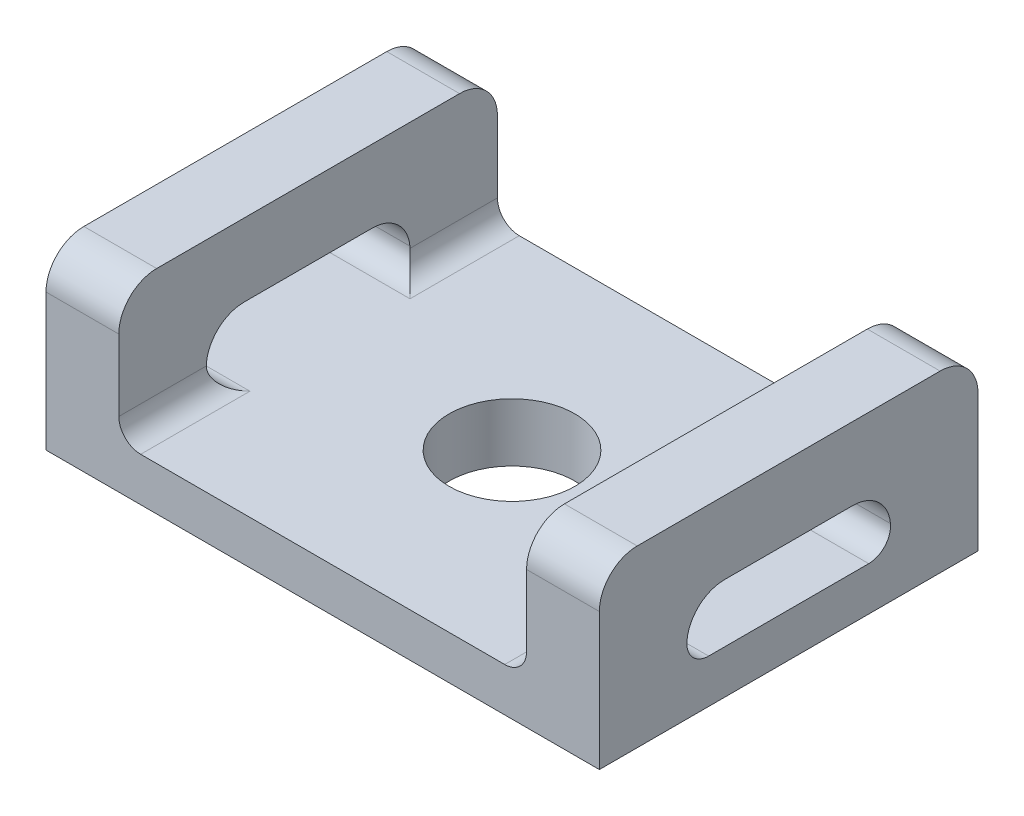
from build123d import *

# Parameters (mm, degrees)
SKETCH1_W               = 19
SKETCH1_H               = 13
SKETCH1_R               = 2.159
BOSS_EXTRUDE1_DEPTH     = 2
BOSS_EXTRUDE2_DEPTH     = 19
CUT_EXTRUDE1_DEPTH      = 18.363755354
CUT_EXTRUDE1_DEPTH_BACK = 18.363755354
SKETCH4_W               = 14
SKETCH4_H               = 5
FILLET1_R               = 0.75
CHAMFER1_SIZE           = 0.5


with BuildPart() as part:
    # Sketch1 → Boss-Extrude1 (new body)
    with BuildSketch(Plane(origin=(0, 0, 0), x_dir=(1, 0, 0), z_dir=(0, 1, 0))):
        Rectangle(SKETCH1_W, SKETCH1_H)
        with Locations(Location((0, 0, 0), (0, 0, 270))):
            Circle(SKETCH1_R, mode=Mode.SUBTRACT)
    extrude(amount=BOSS_EXTRUDE1_DEPTH)

    # Sketch2 → Boss-Extrude2 (add)
    with BuildSketch(Plane(origin=(9.5, 0, 0), x_dir=(0, 0, -1), z_dir=(1, 0, 0))):
        with BuildLine():
            Line((-6.5, 5.2), (-6.5, 2))
            Line((-6.5, 2), (-3.5, 2))
            Line((-3.5, 2), (-3.5, 2.7))
            ThreePointArc((-3.5, 2.7), (-3.119238816, 3.619238816), (-2.2, 4))
            Line((-2.2, 4), (2.2, 4))
            ThreePointArc((2.2, 4), (3.119238816, 3.619238816), (3.5, 2.7))
            Line((3.5, 2.7), (3.5, 2))
            Line((3.5, 2), (6.5, 2))
            Line((6.5, 2), (6.5, 5.2))
            ThreePointArc((6.5, 5.2), (6.119238816, 6.119238816), (5.2, 6.5))
            Line((5.2, 6.5), (-5.2, 6.5))
            ThreePointArc((-5.2, 6.5), (-6.119238816, 6.119238816), (-6.5, 5.2))
        make_face()
    extrude(amount=-BOSS_EXTRUDE2_DEPTH)

    # Sketch4 → Cut-Extrude1 (cut, two sides: drawn at the far end of the back side and taken through both)
    with BuildSketch(Plane.XY.offset(6.5).offset(-CUT_EXTRUDE1_DEPTH_BACK)):
        with Locations((0, 4.5)):
            Rectangle(SKETCH4_W, SKETCH4_H)
    extrude(amount=CUT_EXTRUDE1_DEPTH + CUT_EXTRUDE1_DEPTH_BACK, mode=Mode.SUBTRACT)

    # Fillet1
    # the kernel refuses this fillet: 0.75 mm, written as the material it adds along each edge
    with BuildSketch(Plane(origin=(-7, 2, 3.5), x_dir=(1, 0, 0), z_dir=(0, 0, 1)), Plane(origin=(-7, 2, -6.5), x_dir=(1, 0, 0), z_dir=(0, 0, 1))) as fillet1_piece_1:
        with BuildLine():
            CenterArc((FILLET1_R, FILLET1_R), FILLET1_R, 180, 90)
            Line((0, FILLET1_R), (-FILLET1_R * 0.02, FILLET1_R))
            Line((-FILLET1_R * 0.02, FILLET1_R), (-FILLET1_R * 0.02, -FILLET1_R * 0.02))
            Line((-FILLET1_R * 0.02, -FILLET1_R * 0.02), (FILLET1_R, -FILLET1_R * 0.02))
            Line((FILLET1_R, -FILLET1_R * 0.02), (FILLET1_R, 0))
        make_face()
    extrude(amount=3)
    with BuildSketch(Plane(origin=(-7, 2, 3.5), x_dir=(0, 0, -1), z_dir=(-1, 0, 0)), Plane(origin=(9.5, 2, 3.5), x_dir=(0, 0, -1), z_dir=(-1, 0, 0))) as fillet1_piece_2:
        with BuildLine():
            CenterArc((0.752277442, -0.75), FILLET1_R, 90, 95.21590857)
            Line((0.005383046, -0.818181818), (-0.069306394, -0.825))
            ThreePointArc((-0.069306394, -0.825), (-0.075, -0.7), (-0.075, 0))
            Line((-0.075, 0), (0, 0.075))
            Line((0, 0.075), (0.752277442, 0.075))
            Line((0.752277442, 0.075), (0.752277442, 0))
        make_face()
    extrude(amount=2.5)
    with BuildSketch(Plane(origin=(7, 2, 6.5), x_dir=(0, 1, 0), z_dir=(0, 0, -1)), Plane(origin=(7, 2, -3.5), x_dir=(0, 1, 0), z_dir=(0, 0, -1))) as fillet1_piece_3:
        with BuildLine():
            CenterArc((FILLET1_R, -FILLET1_R), FILLET1_R, 90, 90)
            Line((0, -FILLET1_R), (-FILLET1_R * 0.02, -FILLET1_R))
            Line((-FILLET1_R * 0.02, -FILLET1_R), (-FILLET1_R * 0.02, FILLET1_R * 0.02))
            Line((-FILLET1_R * 0.02, FILLET1_R * 0.02), (FILLET1_R, FILLET1_R * 0.02))
            Line((FILLET1_R, FILLET1_R * 0.02), (FILLET1_R, 0))
        make_face()
    extrude(amount=3)
    with BuildSketch(Plane(origin=(9.5, 2, -3.5), x_dir=(0, 0, 1), z_dir=(-1, 0, 0)), Plane(origin=(-7, 2, -3.5), x_dir=(0, 0, 1), z_dir=(-1, 0, 0))) as fillet1_piece_4:
        with BuildLine():
            CenterArc((0.752277442, 0.75), FILLET1_R, 174.78409143, 95.21590857)
            Line((0.005383046, 0.818181818), (-0.069306394, 0.825))
            ThreePointArc((-0.069306394, 0.825), (-0.075, 0.7), (-0.075, 0))
            Line((-0.075, 0), (0, -0.075))
            Line((0, -0.075), (0.752277442, -0.075))
            Line((0.752277442, -0.075), (0.752277442, 0))
        make_face()
    extrude(amount=2.5)
    with BuildSketch(Plane(origin=(-7, 2, 1.625), x_dir=(1, 0, 0), z_dir=(0, 0, 1))) as fillet1_piece_5a_section:
        with BuildLine():
            CenterArc((FILLET1_R, FILLET1_R), FILLET1_R, 180, 90)
            Line((0, FILLET1_R), (-FILLET1_R * 0.02, FILLET1_R))
            Line((-FILLET1_R * 0.02, FILLET1_R), (-FILLET1_R * 0.02, -FILLET1_R * 0.02))
            Line((-FILLET1_R * 0.02, -FILLET1_R * 0.02), (FILLET1_R, -FILLET1_R * 0.02))
            Line((FILLET1_R, -FILLET1_R * 0.02), (FILLET1_R, 0))
        make_face()
    fillet1_piece_5a = extrude(amount=4.875, mode=Mode.PRIVATE)
    fillet1_piece_5a = split(fillet1_piece_5a, bisect_by=Plane(origin=(-6.830203664, 2.169796336, 3.5), z_dir=(0, 0, -1)), keep=Keep.TOP, mode=Mode.PRIVATE)
    with BuildSketch(Plane(origin=(-4.954501184, 2, 3.5), x_dir=(0, 0, -1), z_dir=(-1, 0, 0))) as fillet1_piece_5b_section:
        with BuildLine():
            CenterArc((0.752277442, -0.75), FILLET1_R, 90, 95.21590857)
            Line((0.005383046, -0.818181818), (-0.069306394, -0.825))
            ThreePointArc((-0.069306394, -0.825), (-0.075, -0.7), (-0.075, 0))
            Line((-0.075, 0), (0, 0.075))
            Line((0, 0.075), (0.752277442, 0.075))
            Line((0.752277442, 0.075), (0.752277442, 0))
        make_face()
    fillet1_piece_5b = extrude(amount=4.545498816, mode=Mode.PRIVATE)
    fillet1_piece_5b = split(fillet1_piece_5b, bisect_by=Plane(origin=(-7, 2.182819777, 3.341220423), z_dir=(1, 0, 0)), keep=Keep.TOP, mode=Mode.PRIVATE)
    fillet1_piece_5 = fillet1_piece_5a & fillet1_piece_5b
    add(fillet1_piece_5)
    with BuildSketch(Plane(origin=(7, 2, 6.5), x_dir=(0, 1, 0), z_dir=(0, 0, -1))) as fillet1_piece_6a_section:
        with BuildLine():
            CenterArc((FILLET1_R, -FILLET1_R), FILLET1_R, 90, 90)
            Line((0, -FILLET1_R), (-FILLET1_R * 0.02, -FILLET1_R))
            Line((-FILLET1_R * 0.02, -FILLET1_R), (-FILLET1_R * 0.02, FILLET1_R * 0.02))
            Line((-FILLET1_R * 0.02, FILLET1_R * 0.02), (FILLET1_R, FILLET1_R * 0.02))
            Line((FILLET1_R, FILLET1_R * 0.02), (FILLET1_R, 0))
        make_face()
    fillet1_piece_6a = extrude(amount=4.875, mode=Mode.PRIVATE)
    fillet1_piece_6a = split(fillet1_piece_6a, bisect_by=Plane(origin=(6.830203664, 2.169796336, 3.5), z_dir=(0, 0, -1)), keep=Keep.TOP, mode=Mode.PRIVATE)
    with BuildSketch(Plane(origin=(9.5, 2, 3.5), x_dir=(0, 0, -1), z_dir=(-1, 0, 0))) as fillet1_piece_6b_section:
        with BuildLine():
            CenterArc((0.752277442, -0.75), FILLET1_R, 90, 95.21590857)
            Line((0.005383046, -0.818181818), (-0.069306394, -0.825))
            ThreePointArc((-0.069306394, -0.825), (-0.075, -0.7), (-0.075, 0))
            Line((-0.075, 0), (0, 0.075))
            Line((0, 0.075), (0.752277442, 0.075))
            Line((0.752277442, 0.075), (0.752277442, 0))
        make_face()
    fillet1_piece_6b = extrude(amount=4.545498816, mode=Mode.PRIVATE)
    fillet1_piece_6b = split(fillet1_piece_6b, bisect_by=Plane(origin=(7, 2.182819777, 3.341220423), z_dir=(-1, 0, 0)), keep=Keep.TOP, mode=Mode.PRIVATE)
    fillet1_piece_6 = fillet1_piece_6a & fillet1_piece_6b
    add(fillet1_piece_6)
    with BuildSketch(Plane(origin=(7, 2, -1.625), x_dir=(0, 1, 0), z_dir=(0, 0, -1))) as fillet1_piece_7a_section:
        with BuildLine():
            CenterArc((FILLET1_R, -FILLET1_R), FILLET1_R, 90, 90)
            Line((0, -FILLET1_R), (-FILLET1_R * 0.02, -FILLET1_R))
            Line((-FILLET1_R * 0.02, -FILLET1_R), (-FILLET1_R * 0.02, FILLET1_R * 0.02))
            Line((-FILLET1_R * 0.02, FILLET1_R * 0.02), (FILLET1_R, FILLET1_R * 0.02))
            Line((FILLET1_R, FILLET1_R * 0.02), (FILLET1_R, 0))
        make_face()
    fillet1_piece_7a = extrude(amount=4.875, mode=Mode.PRIVATE)
    fillet1_piece_7a = split(fillet1_piece_7a, bisect_by=Plane(origin=(6.830203664, 2.169796336, -3.5), z_dir=(0, 0, 1)), keep=Keep.TOP, mode=Mode.PRIVATE)
    with BuildSketch(Plane(origin=(9.5, 2, -3.5), x_dir=(0, 0, 1), z_dir=(-1, 0, 0))) as fillet1_piece_7b_section:
        with BuildLine():
            CenterArc((0.752277442, 0.75), FILLET1_R, 174.78409143, 95.21590857)
            Line((0.005383046, 0.818181818), (-0.069306394, 0.825))
            ThreePointArc((-0.069306394, 0.825), (-0.075, 0.7), (-0.075, 0))
            Line((-0.075, 0), (0, -0.075))
            Line((0, -0.075), (0.752277442, -0.075))
            Line((0.752277442, -0.075), (0.752277442, 0))
        make_face()
    fillet1_piece_7b = extrude(amount=4.545498816, mode=Mode.PRIVATE)
    fillet1_piece_7b = split(fillet1_piece_7b, bisect_by=Plane(origin=(7, 2.182819777, -3.341220423), z_dir=(-1, 0, 0)), keep=Keep.TOP, mode=Mode.PRIVATE)
    fillet1_piece_7 = fillet1_piece_7a & fillet1_piece_7b
    add(fillet1_piece_7)
    with BuildSketch(Plane(origin=(-4.954501184, 2, -3.5), x_dir=(0, 0, 1), z_dir=(-1, 0, 0))) as fillet1_piece_8a_section:
        with BuildLine():
            CenterArc((0.752277442, 0.75), FILLET1_R, 174.78409143, 95.21590857)
            Line((0.005383046, 0.818181818), (-0.069306394, 0.825))
            ThreePointArc((-0.069306394, 0.825), (-0.075, 0.7), (-0.075, 0))
            Line((-0.075, 0), (0, -0.075))
            Line((0, -0.075), (0.752277442, -0.075))
            Line((0.752277442, -0.075), (0.752277442, 0))
        make_face()
    fillet1_piece_8a = extrude(amount=4.545498816, mode=Mode.PRIVATE)
    fillet1_piece_8a = split(fillet1_piece_8a, bisect_by=Plane(origin=(-7, 2.182819777, -3.341220423), z_dir=(1, 0, 0)), keep=Keep.TOP, mode=Mode.PRIVATE)
    with BuildSketch(Plane(origin=(-7, 2, -6.5), x_dir=(1, 0, 0), z_dir=(0, 0, 1))) as fillet1_piece_8b_section:
        with BuildLine():
            CenterArc((FILLET1_R, FILLET1_R), FILLET1_R, 180, 90)
            Line((0, FILLET1_R), (-FILLET1_R * 0.02, FILLET1_R))
            Line((-FILLET1_R * 0.02, FILLET1_R), (-FILLET1_R * 0.02, -FILLET1_R * 0.02))
            Line((-FILLET1_R * 0.02, -FILLET1_R * 0.02), (FILLET1_R, -FILLET1_R * 0.02))
            Line((FILLET1_R, -FILLET1_R * 0.02), (FILLET1_R, 0))
        make_face()
    fillet1_piece_8b = extrude(amount=4.875, mode=Mode.PRIVATE)
    fillet1_piece_8b = split(fillet1_piece_8b, bisect_by=Plane(origin=(-6.830203664, 2.169796336, -3.5), z_dir=(0, 0, 1)), keep=Keep.TOP, mode=Mode.PRIVATE)
    fillet1_piece_8 = fillet1_piece_8a & fillet1_piece_8b
    add(fillet1_piece_8)

    # Chamfer1
    chamfer1_edges = [part.edges().sort_by_distance(p)[0] for p in [
        (0, 0, 6.5),
        (-9.5, 0, 0),
        (0, 0, -6.5),
        (9.5, 0, 0),
    ]]
    chamfer(chamfer1_edges, length=CHAMFER1_SIZE)


solid = part.part
